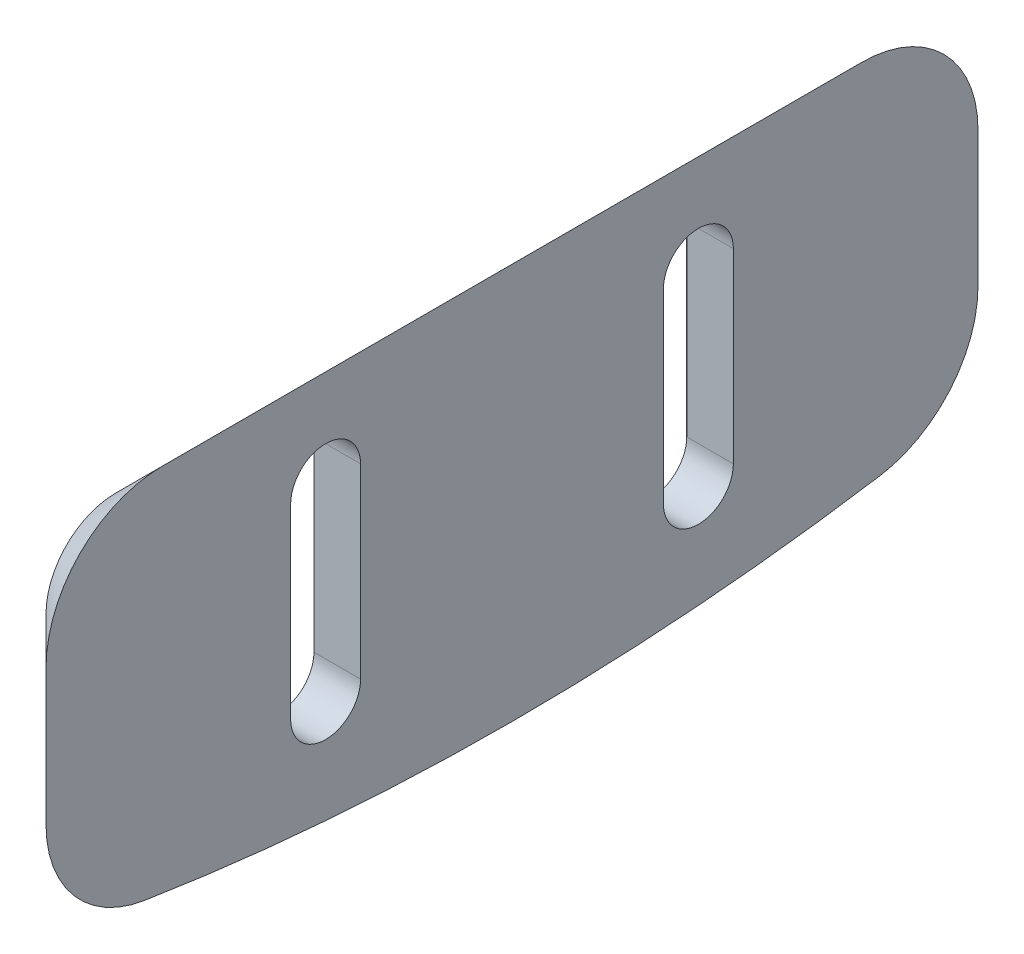
from build123d import *

# Parameters (mm, degrees)
EXTRUDE_1_DEPTH     = 2
CUT_EXTRUDE_1_DEPTH = 2
FILLET_1_R          = 5
CHAMFER_1_SIZE      = 2


with BuildPart() as part:
    # 草图1 → 凸台-拉伸1 (new body)
    with BuildSketch(Plane(origin=(0, 0, 0), x_dir=(0, 0, -1), z_dir=(1, 0, 0))):
        with BuildLine():
            Line((-20, 2), (-20, 17))
            Line((-20, 17), (20, 17))
            Line((20, 17), (20, 2))
            ThreePointArc((20, 2), (0, 0), (-20, 2))
        make_face()
    extrude(amount=EXTRUDE_1_DEPTH)

    # 草图2 → 切除-拉伸1 (cut)
    with BuildSketch(Plane(origin=(2, 0, 0), x_dir=(0, 0, -1), z_dir=(1, 0, 0))):
        with BuildLine():
            Line((-9.5, 4.832177939), (-9.5, 12.832177939))
            ThreePointArc((-9.5, 12.832177939), (-8, 14.332177939), (-6.5, 12.832177939))
            Line((-6.5, 12.832177939), (-6.5, 4.832177939))
            ThreePointArc((-6.5, 4.832177939), (-8, 3.332177939), (-9.5, 4.832177939))
        make_face()
        with BuildLine():
            Line((9.5, 4.832177939), (9.5, 12.832177939))
            ThreePointArc((9.5, 12.832177939), (8, 14.332177939), (6.5, 12.832177939))
            Line((6.5, 12.832177939), (6.5, 4.832177939))
            ThreePointArc((6.5, 4.832177939), (8, 3.332177939), (9.5, 4.832177939))
        make_face()
    extrude(amount=-CUT_EXTRUDE_1_DEPTH, mode=Mode.SUBTRACT)

    # 圆角1
    fillet_1_edges = [part.edges().sort_by_distance(p)[0] for p in [
        (1, 2, -20),
        (1, 2, 20),
        (1, 17, 20),
        (1, 17, -20),
    ]]
    fillet(fillet_1_edges, radius=FILLET_1_R)

    # 倒角1
    chamfer_1_edges = [part.edges().sort_by_distance(p)[0] for p in [
        (0, 0, 0),
        (0, 2.93152096, -18.801726581),
        (0, 2.93152096, 18.801726581),
        (0, 9.089558112, -20),
        (0, 9.089558112, 20),
        (0, 15.535533906, -18.535533906),
        (0, 15.535533906, 18.535533906),
        (0, 17, 0),
    ]]
    chamfer(chamfer_1_edges, length=CHAMFER_1_SIZE - 0.0001)  # a hair under: the kernel refuses the full size


solid = part.part
